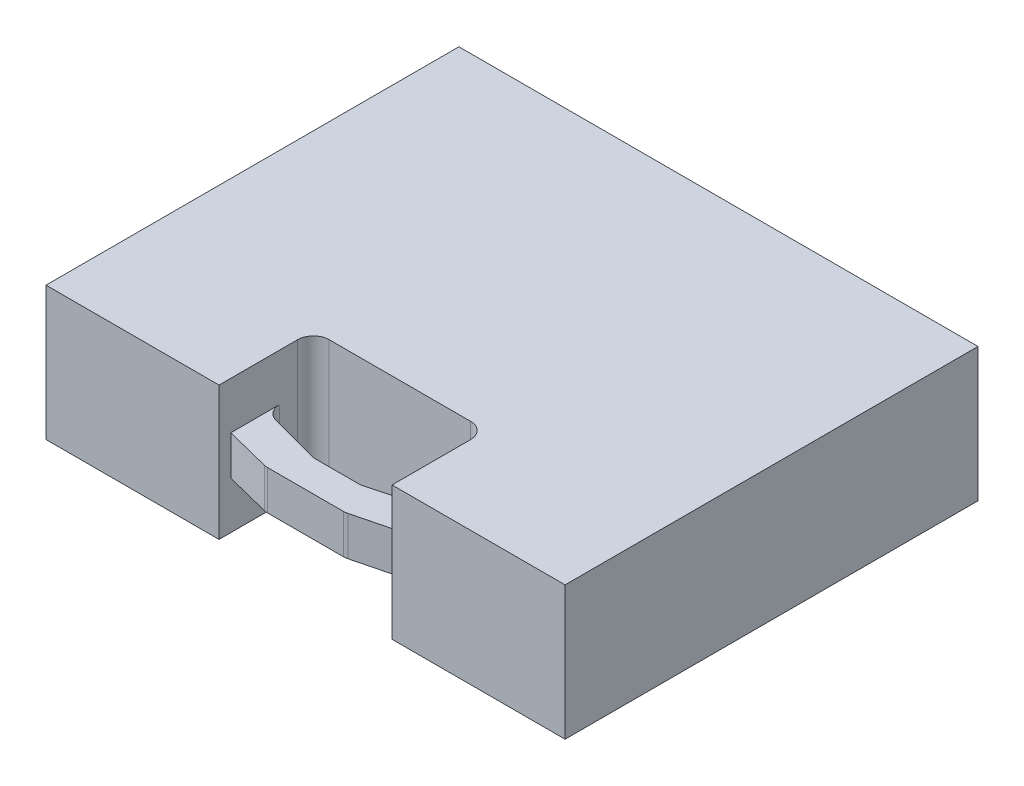
from build123d import *

# Parameters (mm, degrees)
SKETCH1_W           = 419.1
SKETCH1_H           = 333.375
BOSS_EXTRUDE1_DEPTH = 107.95
SKETCH2_W           = 139.7
SKETCH2_H           = 50.8
CUT_EXTRUDE1_DEPTH  = 289.702489868
CHAMFER1_SIZE       = 50.8
CHAMFER1_SIZE2      = 13.611818976
FILLET1_R           = 12.7
SKETCH3_W           = 139.7
SKETCH3_H           = 56.403006085
CUT_EXTRUDE2_DEPTH  = 38.1
SKETCH4_W           = 139.7
SKETCH4_H           = 56.128435861
CUT_EXTRUDE3_DEPTH  = 38.1


with BuildPart() as part:
    # Sketch1 → Boss-Extrude1 (new body)
    with BuildSketch(Plane(origin=(0, 0, 0), x_dir=(1, 0, 0), z_dir=(0, 1, 0))):
        Rectangle(SKETCH1_W, SKETCH1_H)
    extrude(amount=BOSS_EXTRUDE1_DEPTH)

    # Sketch2 → Cut-Extrude1 (cut, through all)
    with BuildSketch(Plane(origin=(0, 107.95, 0), x_dir=(1, 0, 0), z_dir=(0, 1, 0))):
        with Locations((0, -115.8875)):
            Rectangle(SKETCH2_W, SKETCH2_H)
        Polygon((-69.85, -166.6875), (-69.85, -157.1625), (-32.169017961, -166.6875), align=None)
        Polygon((32.169017961, -166.6875), (69.85, -166.6875), (69.85, -157.1625), align=None)
    extrude(amount=-CUT_EXTRUDE1_DEPTH, mode=Mode.SUBTRACT)

    # Chamfer1
    chamfer1_edges = [part.edges().sort_by_distance(p)[0] for p in [
        (69.85, 53.975, 141.2875),
        (-69.85, 53.975, 141.2875),
    ]]
    chamfer1_side = [part.faces().sort_by_distance(p)[0] for p in [
        (0, 53.975, 141.2875),
    ]]
    chamfer(chamfer1_edges, length=CHAMFER1_SIZE, length2=CHAMFER1_SIZE2, reference=chamfer1_side[0])

    # Fillet1
    fillet1_edges = [part.edges().sort_by_distance(p)[0] for p in [
        (32.169017961, 53.975, 166.6875),
        (-32.169017961, 53.975, 166.6875),
        (69.85, 53.975, 127.675681024),
        (19.05, 53.975, 141.2875),
        (-19.05, 53.975, 141.2875),
        (-69.85, 53.975, 127.675681024),
        (69.85, 53.975, 90.4875),
        (-69.85, 53.975, 90.4875),
    ]]
    fillet(fillet1_edges, radius=FILLET1_R)

    # Sketch3 → Cut-Extrude2 (cut)
    with BuildSketch(Plane(origin=(0, 107.95, 0), x_dir=(1, 0, 0), z_dir=(0, 1, 0))):
        with Locations((0, -138.485996957)):
            Rectangle(SKETCH3_W, SKETCH3_H)
    extrude(amount=-CUT_EXTRUDE2_DEPTH, mode=Mode.SUBTRACT)

    # Sketch4 → Cut-Extrude3 (cut)
    with BuildSketch(Plane.XZ):
        with Locations((0, 138.623282069)):
            Rectangle(SKETCH4_W, SKETCH4_H)
    extrude(amount=-CUT_EXTRUDE3_DEPTH, mode=Mode.SUBTRACT)


solid = part.part
